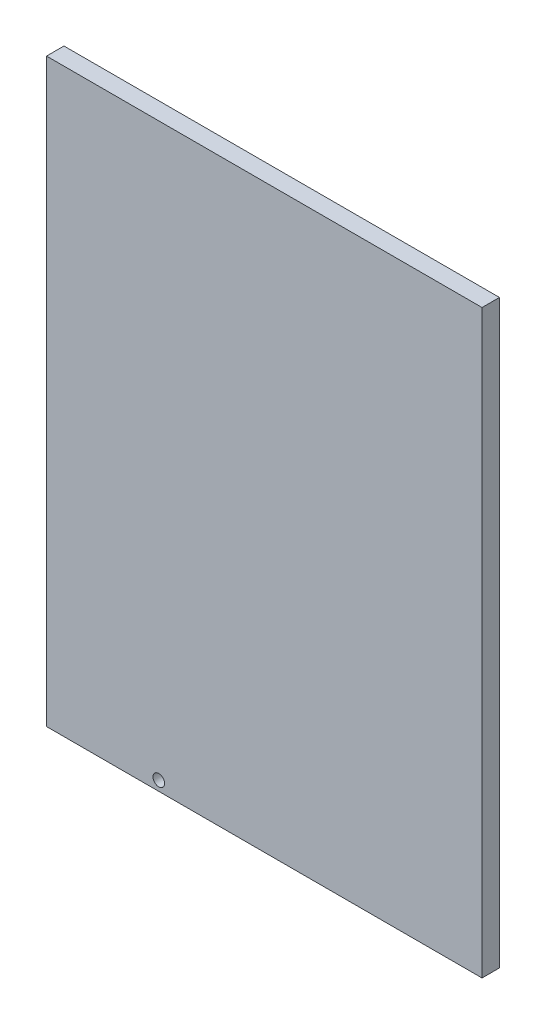
from build123d import *

# Parameters (mm, degrees)
SKETCH1_W           = 225
SKETCH1_H           = 300
BOSS_EXTRUDE1_DEPTH = 9
SKETCH2_R           = 3
CUT_EXTRUDE4_DEPTH  = 188.715875727


with BuildPart() as part:
    # Sketch1 → Boss-Extrude1 (new body)
    with BuildSketch(Plane.XY):
        Rectangle(SKETCH1_W, SKETCH1_H)
    extrude(amount=BOSS_EXTRUDE1_DEPTH)

    # Sketch2 → Cut-Extrude4 (cut, through all)
    with BuildSketch(Plane.XY.offset(9)):
        with Locations((-54.5, -145)):
            Circle(SKETCH2_R)
    extrude(amount=-CUT_EXTRUDE4_DEPTH, mode=Mode.SUBTRACT)


solid = part.part
